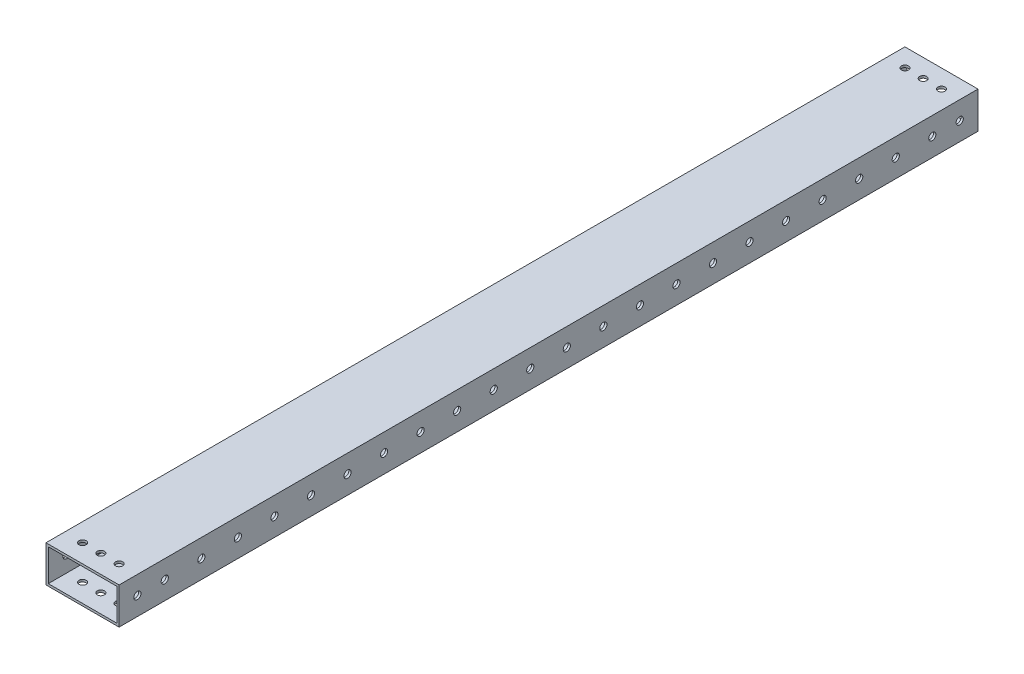
from build123d import *

# Parameters (mm, degrees)
SKETCH1_W           = 50.8
SKETCH1_H           = 25.4
BOSS_EXTRUDE1_DEPTH = 298.45
SHELL1_T            = -1.5875
SKETCH2_R           = 2.4892
CUT_EXTRUDE1_DEPTH  = 304.806192333
SKETCH3_R           = 2.4892
CUT_EXTRUDE2_DEPTH  = 304.806192333
SKETCH4_R           = 2.4892
CUT_EXTRUDE3_DEPTH  = 304.806192333
LPATTERN1_COUNT     = 22
LPATTERN1_PITCH     = 25.4


with BuildPart() as part:
    # Sketch1 → Boss-Extrude1 (new, symmetric)
    with BuildSketch(Plane.XY):
        with Locations((25.4, 12.7)):
            Rectangle(SKETCH1_W, SKETCH1_H)
    extrude(amount=BOSS_EXTRUDE1_DEPTH, both=True)

    # Shell1
    shell1_openings = [part.faces().sort_by_distance(p)[0] for p in [
        (25.4, 12.7, -298.45),
        (25.4, 12.7, 298.45),
    ]]
    offset(amount=SHELL1_T, openings=shell1_openings, kind=Kind.INTERSECTION)

    # Sketch2 → Cut-Extrude1 (cut, through all)
    with BuildSketch(Plane(origin=(0, 25.4, 0), x_dir=(1, 0, 0), z_dir=(0, 1, 0))):
        with Locations((38.1, -285.75)):
            Circle(SKETCH2_R)
        with Locations((25.4, -285.75)):
            Circle(SKETCH2_R)
        with Locations((12.7, -285.75)):
            Circle(SKETCH2_R)
    cut_extrude1 = extrude(amount=-CUT_EXTRUDE1_DEPTH, mode=Mode.SUBTRACT)

    # Sketch3 → Cut-Extrude2 (cut, through all)
    with BuildSketch(Plane(origin=(50.8, 0, 0), x_dir=(0, 0, -1), z_dir=(1, 0, 0))):
        with Locations((-285.75, 12.7)):
            Circle(SKETCH3_R)
    cut_extrude2 = extrude(amount=-CUT_EXTRUDE2_DEPTH, mode=Mode.SUBTRACT)

    # Mirror1: Cut-Extrude1, Cut-Extrude2 across plane
    add(cut_extrude1.mirror(Plane.XY), mode=Mode.SUBTRACT)
    add(cut_extrude2.mirror(Plane.XY), mode=Mode.SUBTRACT)

    # Sketch4 → Cut-Extrude3 (cut, symmetric)
    with BuildSketch(Plane(origin=(50.8, 0, 0), x_dir=(0, 0, -1), z_dir=(1, 0, 0))):
        with Locations((-266.7, 12.7)):
            Circle(SKETCH4_R)
    cut_extrude3 = extrude(amount=CUT_EXTRUDE3_DEPTH, both=True, mode=Mode.SUBTRACT)

    # LPattern1: Cut-Extrude3 ×22
    with Locations(*[(0, 0, -i * LPATTERN1_PITCH) for i in range(1, LPATTERN1_COUNT)]):
        add(cut_extrude3, mode=Mode.SUBTRACT)


solid = part.part
